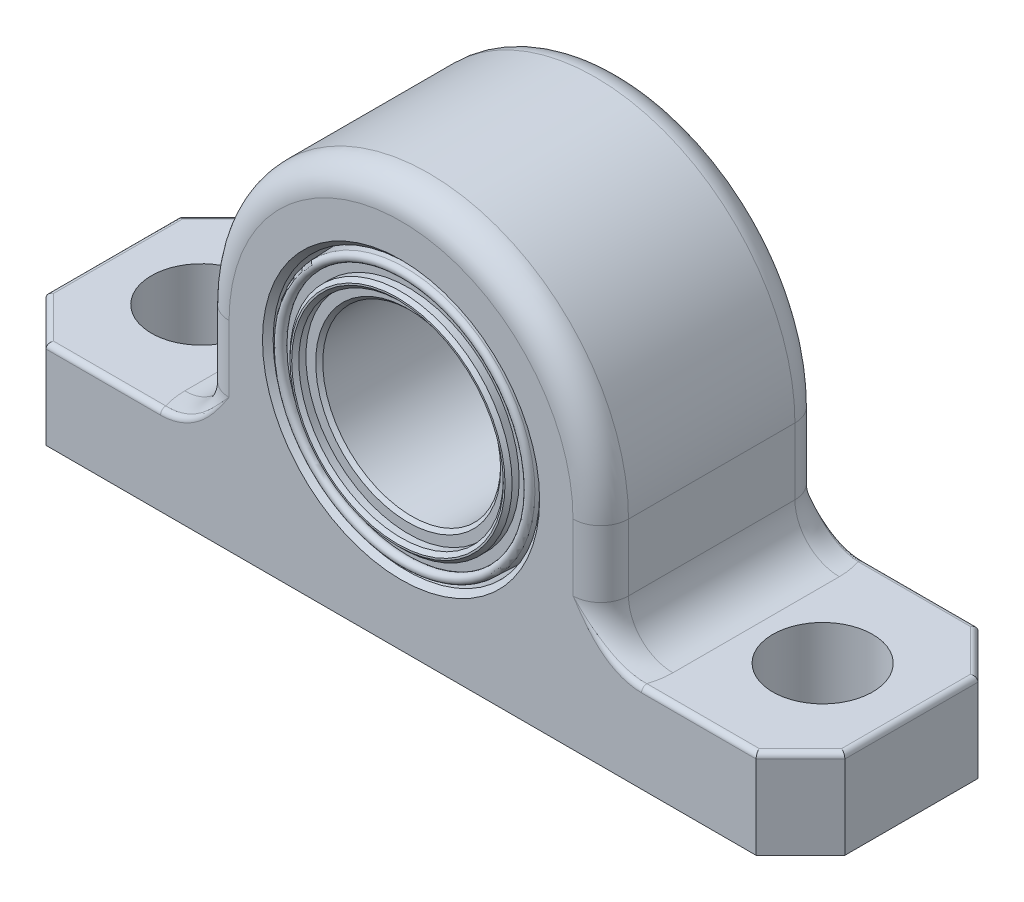
from build123d import *

# Parameters (mm, degrees)
BOSS_EXTRUDE1_DEPTH      = 7.9375
BOSS_EXTRUDE1_DEPTH_BACK = 7.9375
SKETCH3_R                = 9.53262
SKETCH4_R                = 3.571875
CUT_EXTRUDE1_DEPTH       = 42.183311623
CHAMFER1_SIZE            = 3.175
FILLET1_R                = 1.984375
FILLET2_R                = 3.175
CHAMFER2_SIZE            = 0.381
FILLET3_R                = 0.381
CHAMFER3_SIZE            = 0.254


with BuildPart() as part:
    # Sketch3 → Boss-Extrude1 (new, two sides: drawn at the far end of the back side and taken through both)
    with BuildSketch(Plane.XY.offset(-BOSS_EXTRUDE1_DEPTH_BACK)):
        with BuildLine():
            Line((-28.575, 0), (-28.575, 6.35))
            Line((-28.575, 6.35), (-14.2875, 6.35))
            Line((-14.2875, 6.35), (-14.2875, 14.2875))
            ThreePointArc((-14.2875, 14.2875), (0, 28.575), (14.2875, 14.2875))
            Line((14.2875, 14.2875), (14.2875, 6.35))
            Line((14.2875, 6.35), (28.575, 6.35))
            Line((28.575, 6.35), (28.575, 0))
            Line((28.575, 0), (-28.575, 0))
        make_face()
        with Locations((0, 14.2875)):
            Circle(SKETCH3_R, mode=Mode.SUBTRACT)
    extrude(amount=BOSS_EXTRUDE1_DEPTH + BOSS_EXTRUDE1_DEPTH_BACK)

    # Sketch4 → Cut-Extrude1 (cut, through all)
    with BuildSketch(Plane(origin=(0, 0, 0), x_dir=(1, 0, 0), z_dir=(0, 1, 0))):
        with Locations(Location((-22.225, 0, 0), (0, 0, 270))):
            Circle(SKETCH4_R)
        with Locations(Location((22.225, 0, 0), (0, 0, 270))):
            Circle(SKETCH4_R)
    extrude(amount=CUT_EXTRUDE1_DEPTH, mode=Mode.SUBTRACT)

    # Chamfer1
    chamfer1_edges = [part.edges().sort_by_distance(p)[0] for p in [
        (28.575, 3.175, 7.9375),
        (-28.575, 3.175, -7.9375),
        (-28.575, 3.175, 7.9375),
        (28.575, 3.175, -7.9375),
    ]]
    chamfer(chamfer1_edges, length=CHAMFER1_SIZE)

    # Fillet1
    fillet1_edges = [part.edges().sort_by_distance(p)[0] for p in [
        (14.2875, 10.31875, -7.9375),
        (0, 28.575, -7.9375),
        (-14.2875, 10.31875, -7.9375),
        (14.2875, 10.31875, 7.9375),
        (0, 28.575, 7.9375),
        (-14.2875, 10.31875, 7.9375),
    ]]
    fillet(fillet1_edges, radius=FILLET1_R)

    # Fillet2
    # the kernel refuses this fillet: 3.175 mm, written as the material it adds along each edge
    with BuildSketch(Plane(origin=(-14.2875, 6.35, 5.953125), x_dir=(-1, 0, 0), z_dir=(0, 0, -1))) as fillet2_piece_1:
        with BuildLine():
            CenterArc((FILLET2_R, FILLET2_R), FILLET2_R, 180, 90)
            Line((0, FILLET2_R), (0, 0))
            Line((0, 0), (FILLET2_R, 0))
        make_face()
    extrude(amount=11.90625)
    with BuildSketch(Plane(origin=(14.2875, 6.35, 5.953125), x_dir=(1, 0, 0), z_dir=(0, 0, -1))) as fillet2_piece_2:
        with BuildLine():
            CenterArc((FILLET2_R, -FILLET2_R), FILLET2_R, 90, 90)
            Line((0, -FILLET2_R), (0, 0))
            Line((0, 0), (FILLET2_R, 0))
        make_face()
    extrude(amount=11.90625)
    with BuildSketch(Plane(origin=(-12.303125, 6.35, -5.953125), x_dir=(-0.7578518137495749, 0, 0.6524267226259816), z_dir=(-0.6524267226259816, 0, -0.7578518137495749))) as fillet2_piece_3_section:
        with BuildLine():
            CenterArc((-1.984375 - FILLET2_R, FILLET2_R), FILLET2_R, 270, 90)
            Line((-1.984375, FILLET2_R), (-1.984375, 0))
            Line((-1.984375, 0), (-1.984375 - FILLET2_R, 0))
        make_face()
    fillet2_piece_3 = revolve(axis=Axis((-12.303125, 6.35, -5.953125), (0, 1, 0)), revolution_arc=319.27518278, mode=Mode.PRIVATE)
    fillet2_piece_3 = split(fillet2_piece_3, bisect_by=Plane(origin=(-13.806400039, 7.435141287, -7.9375), z_dir=(0, 0, 1)), keep=Keep.TOP, mode=Mode.PRIVATE)
    add(fillet2_piece_3)
    with BuildSketch(Plane(origin=(-12.303125, 6.35, 5.953125), x_dir=(-0.7578518137495749, 0, -0.6524267226259816), z_dir=(-0.6524267226259816, 0, 0.7578518137495749))) as fillet2_piece_4_section:
        with BuildLine():
            CenterArc((-1.984375 - FILLET2_R, -FILLET2_R), FILLET2_R, 0, 90)
            Line((-1.984375, -FILLET2_R), (-1.984375, 0))
            Line((-1.984375, 0), (-1.984375 - FILLET2_R, 0))
        make_face()
    fillet2_piece_4 = revolve(axis=Axis((-12.303125, 6.35, 5.953125), (0, -1, 0)), revolution_arc=319.27518278, mode=Mode.PRIVATE)
    fillet2_piece_4 = split(fillet2_piece_4, bisect_by=Plane(origin=(-13.806400039, 7.435141287, 7.9375), z_dir=(0, 0, -1)), keep=Keep.TOP, mode=Mode.PRIVATE)
    add(fillet2_piece_4)
    with BuildSketch(Plane(origin=(12.303125, 6.35, -5.953125), x_dir=(0.7578518137495754, 0, 0.6524267226259811), z_dir=(0.6524267226259811, 0, -0.7578518137495754))) as fillet2_piece_5_section:
        with BuildLine():
            CenterArc((-1.984375 - FILLET2_R, -FILLET2_R), FILLET2_R, 360, 90)
            Line((-1.984375, -FILLET2_R), (-1.984375, 0))
            Line((-1.984375, 0), (-1.984375 - FILLET2_R, 0))
        make_face()
    fillet2_piece_5 = revolve(axis=Axis((12.303125, 6.35, -5.953125), (0, -1, 0)), revolution_arc=319.27518278, mode=Mode.PRIVATE)
    fillet2_piece_5 = split(fillet2_piece_5, bisect_by=Plane(origin=(13.806399967, 7.435141595, -7.9375), z_dir=(0, 0, 1)), keep=Keep.TOP, mode=Mode.PRIVATE)
    add(fillet2_piece_5)
    with BuildSketch(Plane(origin=(12.303125, 6.35, 5.953125), x_dir=(0.7578518137495754, 0, -0.6524267226259811), z_dir=(0.6524267226259811, 0, 0.7578518137495754))) as fillet2_piece_6_section:
        with BuildLine():
            CenterArc((-1.984375 - FILLET2_R, FILLET2_R), FILLET2_R, 270, 90)
            Line((-1.984375, FILLET2_R), (-1.984375, 0))
            Line((-1.984375, 0), (-1.984375 - FILLET2_R, 0))
        make_face()
    fillet2_piece_6 = revolve(axis=Axis((12.303125, 6.35, 5.953125), (0, 1, 0)), revolution_arc=319.27518278, mode=Mode.PRIVATE)
    fillet2_piece_6 = split(fillet2_piece_6, bisect_by=Plane(origin=(13.806399967, 7.435141595, 7.9375), z_dir=(0, 0, -1)), keep=Keep.TOP, mode=Mode.PRIVATE)
    add(fillet2_piece_6)

    # Chamfer2
    chamfer2_edges = [part.edges().sort_by_distance(p)[0] for p in [
        (-9.53262, 14.2875, -7.9375),
        (-9.53262, 14.2875, 7.9375),
    ]]
    chamfer(chamfer2_edges, length=CHAMFER2_SIZE)

    # Fillet3
    fillet3_edges = [part.edges().sort_by_distance(p)[0] for p in [
        (-21.2328125, 6.35, -7.9375),
        (-21.2328125, 6.35, 7.9375),
        (-14.328484078, 7.361660922, -7.9375),
        (-14.328484078, 7.361660922, 7.9375),
        (14.328484078, 7.361660922, -7.9375),
        (14.328484078, 7.361660922, 7.9375),
        (-28.575, 6.35, 0),
        (21.2328125, 6.35, -7.9375),
        (-26.9875, 6.35, 6.35),
        (-26.9875, 6.35, -6.35),
        (21.2328125, 6.35, 7.9375),
        (28.575, 6.35, 0),
        (26.9875, 6.35, -6.35),
        (26.9875, 6.35, 6.35),
    ]]
    fillet(fillet3_edges, radius=FILLET3_R)


with BuildPart() as body_2:
    # Sketch6 → Revolve1 (revolve)
    with BuildSketch(Plane(origin=(0, 0, 0), x_dir=(0, 0, -1), z_dir=(1, 0, 0)), mode=Mode.PRIVATE) as revolve1_sk:
        with BuildLine():
            Line((0, 23.82012), (7.9375, 23.82012))
            Line((7.9375, 23.82012), (7.9375, 22.962245545))
            Line((7.9375, 22.962245545), (4.1275, 22.962245545))
            Line((4.1275, 22.962245545), (4.1275, 22.23516))
            Line((4.1275, 22.23516), (6.6675, 22.23516))
            Line((6.6675, 22.23516), (6.6675, 21.604605))
            Line((6.6675, 21.604605), (5.9055, 21.604605))
            Line((5.9055, 21.604605), (5.9055, 20.6502))
            Line((5.9055, 20.6502), (-7.4295, 20.6502))
            Line((-7.4295, 20.6502), (-7.4295, 21.604605))
            Line((-7.4295, 21.604605), (-8.1915, 21.604605))
            Line((-8.1915, 21.604605), (-8.1915, 22.23516))
            Line((-8.1915, 22.23516), (-7.4295, 22.23516))
            Line((-7.4295, 22.23516), (-7.4295, 22.962245545))
            ThreePointArc((-7.4295, 22.962245545), (-7.921207431, 23.128161523), (-7.624429074, 23.55386907))
            Line((-7.624429074, 23.55386907), (0, 23.82012))
        make_face()
    revolve(revolve1_sk.sketch.rotate(Axis((0, 14.2875, 7.9375), (0, 0, -1)), 90), axis=Axis((0, 14.2875, 7.9375), (0, 0, -1)))

    # Chamfer3
    chamfer3_edges = [body_2.edges().sort_by_distance(p)[0] for p in [
        (-7.94766, 14.2875, -6.6675),
        (-7.317105, 14.2875, -6.6675),
        (-6.3627, 14.2875, -5.9055),
        (-6.3627, 14.2875, 7.4295),
        (-7.317105, 14.2875, 8.1915),
        (-7.94766, 14.2875, 8.1915),
    ]]
    chamfer(chamfer3_edges, length=CHAMFER3_SIZE)


solid = Compound([part.part, body_2.part])
